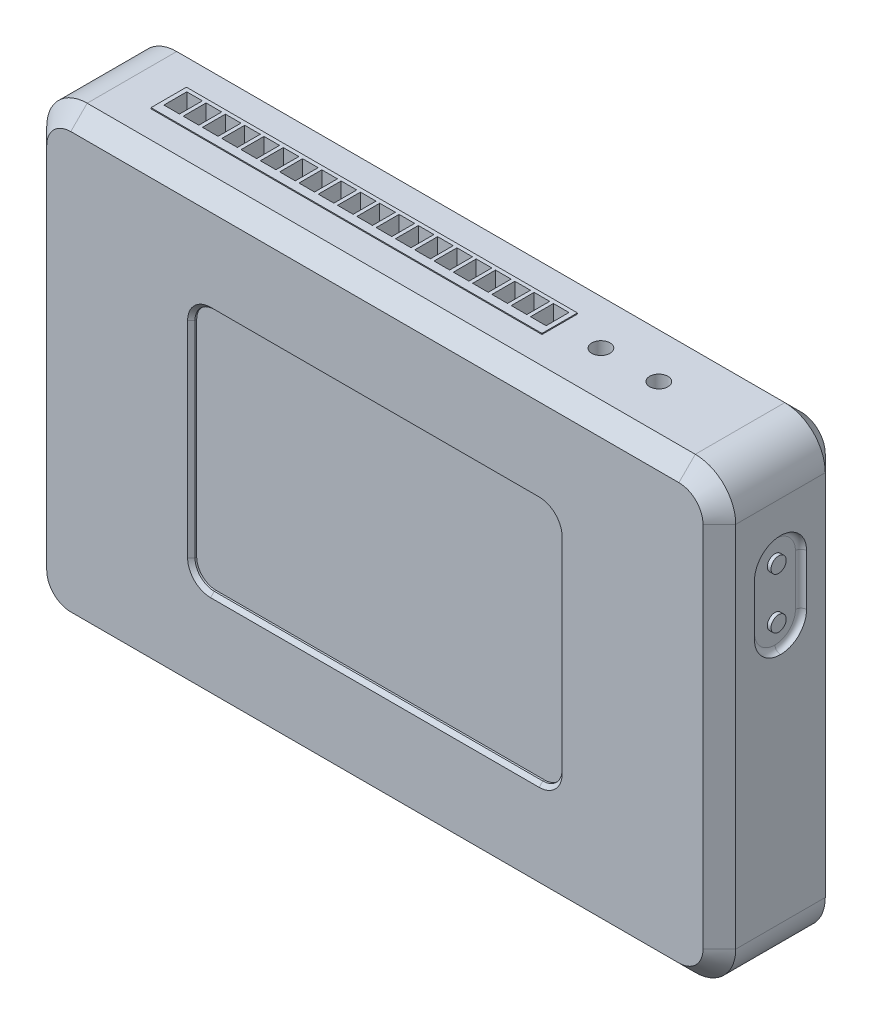
from build123d import *

# Parameters (mm, degrees)
SKETCH1_W           = 136.04687294
SKETCH1_H           = 88.612181424
BOSS_EXTRUDE1_DEPTH = 12.07135
FILLET1_R           = 7.98823523
CHAMFER1_SIZE       = 3.232892188
SKETCH2_W           = 10.287037846
SKETCH2_H           = 20.345437846
CUT_EXTRUDE1_DEPTH  = 1.100644484
FILLET2_R           = 5.143518923
FILLET3_R           = 1.100644484
SKETCH3_R           = 1.5
BOSS_EXTRUDE2_DEPTH = 0.730648272
SKETCH4_R           = 1.7999964
CUT_EXTRUDE2_DEPTH  = 2.54
SKETCH5_W           = 72.4916
SKETCH5_H           = 48.2092
CUT_EXTRUDE3_DEPTH  = 1.0668
FILLET4_R           = 3.81
CHAMFER2_SIZE       = 0.724662508
SKETCH6_W           = 77.2
SKETCH6_H           = 7
BOSS_EXTRUDE3_DEPTH = 0.2
SKETCH7_W           = 3.08
SKETCH7_H           = 4.52
CUT_EXTRUDE4_DEPTH  = 6.95
SKETCH8_W           = 0.8
SKETCH8_H           = 0.8
BOSS_EXTRUDE4_DEPTH = 4.3
SKETCH9_R           = 1.63195
CUT_EXTRUDE5_DEPTH  = 2.54
SKETCH10_W          = 5.67182
SKETCH10_H          = 12.56
SKETCH10_W_2        = 8.4328
SKETCH10_H_2        = 9.3
CUT_EXTRUDE6_DEPTH  = 6.35
CHAMFER3_SIZE       = 2.1866
SKETCH11_W          = 11
SKETCH11_H          = 9
BOSS_EXTRUDE5_DEPTH = 0.508
SKETCH12_R          = 3.2
CUT_EXTRUDE7_DEPTH  = 10
SKETCH13_R          = 1
BOSS_EXTRUDE6_DEPTH = 8
SKETCH14_R          = 1.778
CUT_EXTRUDE8_DEPTH  = 2.75
SKETCH15_W          = 50.8
SKETCH15_H          = 8.8
BOSS_EXTRUDE7_DEPTH = 0.25
CUT_EXTRUDE9_DEPTH  = 6.25
SKETCH17_W          = 0.64
SKETCH17_H          = 0.64
BOSS_EXTRUDE8_DEPTH = 5.5


with BuildPart() as part:
    # Sketch1 → Boss-Extrude1 (new, symmetric)
    with BuildSketch(Plane.XY):
        Rectangle(SKETCH1_W, SKETCH1_H)
    extrude(amount=BOSS_EXTRUDE1_DEPTH, both=True)

    # Fillet1
    fillet1_edges = [part.edges().sort_by_distance(p)[0] for p in [
        (68.02343647, -44.306090712, 0),
        (-68.02343647, -44.306090712, 0),
        (-68.02343647, 44.306090712, 0),
        (68.02343647, 44.306090712, 0),
    ]]
    fillet(fillet1_edges, radius=FILLET1_R)

    # Chamfer1
    chamfer1_edges = [part.edges().sort_by_distance(p)[0] for p in [
        (0, -44.306090712, -12.07135),
        (0, -44.306090712, 12.07135),
        (68.02343647, 0, -12.07135),
        (-68.02343647, 0, -12.07135),
        (0, 44.306090712, -12.07135),
        (65.683736541, -41.966390783, -12.07135),
        (65.683736541, 41.966390783, -12.07135),
        (-65.683736541, 41.966390783, -12.07135),
        (-65.683736541, -41.966390783, -12.07135),
        (-68.02343647, 0, 12.07135),
        (68.02343647, 0, 12.07135),
        (0, 44.306090712, 12.07135),
        (65.683736541, -41.966390783, 12.07135),
        (65.683736541, 41.966390783, 12.07135),
        (-65.683736541, 41.966390783, 12.07135),
        (-65.683736541, -41.966390783, 12.07135),
    ]]
    chamfer(chamfer1_edges, length=CHAMFER1_SIZE)

    # Sketch2 → Cut-Extrude1 (cut)
    with BuildSketch(Plane(origin=(68.02343647, 0, 0), x_dir=(0, 0, -1), z_dir=(1, 0, 0))):
        with Locations((0, 19.801547138)):
            Rectangle(SKETCH2_W, SKETCH2_H)
    extrude(amount=-CUT_EXTRUDE1_DEPTH, mode=Mode.SUBTRACT)

    # Fillet2
    fillet2_edges = [part.edges().sort_by_distance(p)[0] for p in [
        (67.473114228, 9.628828215, -5.143518923),
        (67.473114228, 29.974266061, -5.143518923),
        (67.473114228, 29.974266061, 5.143518923),
        (67.473114228, 9.628828215, 5.143518923),
    ]]
    fillet(fillet2_edges, radius=FILLET2_R - 0.0001)  # a hair under: the kernel refuses the full size

    # Fillet3
    fillet3_edges = [part.edges().sort_by_distance(p)[0] for p in [
        (66.922791986, 28.467793537, 3.637046399),
        (66.922791986, 28.467793537, -3.637046399),
        (66.922791986, 19.801547138, -5.143518923),
        (66.922791986, 11.135300739, -3.637046399),
        (66.922791986, 11.135300739, 3.637046399),
        (66.922791986, 19.801547138, 5.143518923),
    ]]
    fillet(fillet3_edges, radius=FILLET3_R - 0.0001)  # a hair under: the kernel refuses the full size

    # Sketch3 → Boss-Extrude2 (add)
    with BuildSketch(Plane(origin=(66.922791986, 0, 0), x_dir=(0, 0, -1), z_dir=(1, 0, 0))):
        with Locations((0, 24.830747138)):
            Circle(SKETCH3_R)
        with Locations((0, 14.772347138)):
            Circle(SKETCH3_R)
    extrude(amount=BOSS_EXTRUDE2_DEPTH)

    # Sketch4 → Cut-Extrude2 (cut)
    with BuildSketch(Plane(origin=(0, 44.306090712, 0), x_dir=(1, 0, 0), z_dir=(0, 1, 0))):
        with Locations(Location((43.992399188, 0, 0), (0, 0, 270))):
            Circle(SKETCH4_R)
        with Locations(Location((32.562399188, 0, 0), (0, 0, 270))):
            Circle(SKETCH4_R)
    extrude(amount=-CUT_EXTRUDE2_DEPTH, mode=Mode.SUBTRACT)

    # Sketch5 → Cut-Extrude3 (cut)
    with BuildSketch(Plane.XY.offset(12.07135)):
        Rectangle(SKETCH5_W, SKETCH5_H)
    extrude(amount=-CUT_EXTRUDE3_DEPTH, mode=Mode.SUBTRACT)

    # Fillet4
    fillet4_edges = [part.edges().sort_by_distance(p)[0] for p in [
        (-36.2458, -24.1046, 11.53795),
        (-36.2458, 24.1046, 11.53795),
        (36.2458, 24.1046, 11.53795),
        (36.2458, -24.1046, 11.53795),
    ]]
    fillet(fillet4_edges, radius=FILLET4_R)

    # Chamfer2
    chamfer2_edges = [part.edges().sort_by_distance(p)[0] for p in [
        (36.2458, 0, 12.07135),
        (0, -24.1046, 12.07135),
        (0, 24.1046, 12.07135),
        (-36.2458, 0, 12.07135),
        (35.129876836, -22.988676836, 12.07135),
        (35.129876836, 22.988676836, 12.07135),
        (-35.129876836, 22.988676836, 12.07135),
        (-35.129876836, -22.988676836, 12.07135),
    ]]
    chamfer(chamfer2_edges, length=CHAMFER2_SIZE)

    # Sketch6 → Boss-Extrude3 (add)
    with BuildSketch(Plane(origin=(0, 44.306090712, 0), x_dir=(1, 0, 0), z_dir=(0, 1, 0))):
        with Locations((-14.17656353, 0)):
            Rectangle(SKETCH6_W, SKETCH6_H)
    extrude(amount=BOSS_EXTRUDE3_DEPTH)

    # Sketch7 → Cut-Extrude4 (cut)
    with BuildSketch(Plane(origin=(0, 44.506090712, 0), x_dir=(1, 0, 0), z_dir=(0, 1, 0))):
        with Locations((21.98343647, 0.478)):
            Rectangle(SKETCH7_W, SKETCH7_H)
        with Locations((18.17343647, 0.478)):
            Rectangle(SKETCH7_W, SKETCH7_H)
        with Locations((14.36343647, 0.478)):
            Rectangle(SKETCH7_W, SKETCH7_H)
        with Locations((10.55343647, 0.478)):
            Rectangle(SKETCH7_W, SKETCH7_H)
        with Locations((6.74343647, 0.478)):
            Rectangle(SKETCH7_W, SKETCH7_H)
        with Locations((2.93343647, 0.478)):
            Rectangle(SKETCH7_W, SKETCH7_H)
        with Locations((-0.87656353, 0.478)):
            Rectangle(SKETCH7_W, SKETCH7_H)
        with Locations((-4.68656353, 0.478)):
            Rectangle(SKETCH7_W, SKETCH7_H)
        with Locations((-8.49656353, 0.478)):
            Rectangle(SKETCH7_W, SKETCH7_H)
        with Locations((-12.30656353, 0.478)):
            Rectangle(SKETCH7_W, SKETCH7_H)
        with Locations((-16.11656353, 0.478)):
            Rectangle(SKETCH7_W, SKETCH7_H)
        with Locations((-19.92656353, 0.478)):
            Rectangle(SKETCH7_W, SKETCH7_H)
        with Locations((-23.73656353, 0.478)):
            Rectangle(SKETCH7_W, SKETCH7_H)
        with Locations((-27.54656353, 0.478)):
            Rectangle(SKETCH7_W, SKETCH7_H)
        with Locations((-31.35656353, 0.478)):
            Rectangle(SKETCH7_W, SKETCH7_H)
        with Locations((-35.16656353, 0.478)):
            Rectangle(SKETCH7_W, SKETCH7_H)
        with Locations((-38.97656353, 0.478)):
            Rectangle(SKETCH7_W, SKETCH7_H)
        with Locations((-42.78656353, 0.478)):
            Rectangle(SKETCH7_W, SKETCH7_H)
        with Locations((-46.59656353, 0.478)):
            Rectangle(SKETCH7_W, SKETCH7_H)
        with Locations((-50.40656353, 0.478)):
            Rectangle(SKETCH7_W, SKETCH7_H)
    extrude(amount=-CUT_EXTRUDE4_DEPTH, mode=Mode.SUBTRACT)

    # Sketch8 → Boss-Extrude4 (add)
    with BuildSketch(Plane(origin=(0, 37.556090712, 0), x_dir=(1, 0, 0), z_dir=(0, 1, 0))):
        with Locations((18.17343647, 0.478)):
            Rectangle(SKETCH8_W, SKETCH8_H)
        with Locations((21.98343647, 0.478)):
            Rectangle(SKETCH8_W, SKETCH8_H)
        with Locations((14.36343647, 0.478)):
            Rectangle(SKETCH8_W, SKETCH8_H)
        with Locations((10.55343647, 0.478)):
            Rectangle(SKETCH8_W, SKETCH8_H)
        with Locations((6.74343647, 0.478)):
            Rectangle(SKETCH8_W, SKETCH8_H)
        with Locations((2.93343647, 0.478)):
            Rectangle(SKETCH8_W, SKETCH8_H)
        with Locations((-0.87656353, 0.478)):
            Rectangle(SKETCH8_W, SKETCH8_H)
        with Locations((-4.68656353, 0.478)):
            Rectangle(SKETCH8_W, SKETCH8_H)
        with Locations((-8.49656353, 0.478)):
            Rectangle(SKETCH8_W, SKETCH8_H)
        with Locations((-12.30656353, 0.478)):
            Rectangle(SKETCH8_W, SKETCH8_H)
        with Locations((-16.11656353, 0.478)):
            Rectangle(SKETCH8_W, SKETCH8_H)
        with Locations((-19.92656353, 0.478)):
            Rectangle(SKETCH8_W, SKETCH8_H)
        with Locations((-23.73656353, 0.478)):
            Rectangle(SKETCH8_W, SKETCH8_H)
        with Locations((-27.54656353, 0.478)):
            Rectangle(SKETCH8_W, SKETCH8_H)
        with Locations((-31.35656353, 0.478)):
            Rectangle(SKETCH8_W, SKETCH8_H)
        with Locations((-35.16656353, 0.478)):
            Rectangle(SKETCH8_W, SKETCH8_H)
        with Locations((-38.97656353, 0.478)):
            Rectangle(SKETCH8_W, SKETCH8_H)
        with Locations((-42.78656353, 0.478)):
            Rectangle(SKETCH8_W, SKETCH8_H)
        with Locations((-46.59656353, 0.478)):
            Rectangle(SKETCH8_W, SKETCH8_H)
        with Locations((-50.40656353, 0.478)):
            Rectangle(SKETCH8_W, SKETCH8_H)
    extrude(amount=BOSS_EXTRUDE4_DEPTH)

    # Sketch9 → Cut-Extrude5 (cut)
    with BuildSketch(Plane(origin=(0, 0, -12.07135), x_dir=(-1, 0, 0), z_dir=(0, 0, -1))):
        with Locations((44.77656353, 22.1)):
            Circle(SKETCH9_R)
        with Locations((44.77656353, -22.1)):
            Circle(SKETCH9_R)
        with Locations((-35.22343647, 0)):
            Circle(SKETCH9_R)
    extrude(amount=-CUT_EXTRUDE5_DEPTH, mode=Mode.SUBTRACT)

    # Sketch10 → Cut-Extrude6 (cut)
    with BuildSketch(Plane.ZY.offset(68.02343647)):
        with Locations((0, 19.690090712)):
            Rectangle(SKETCH10_W, SKETCH10_H)
        with Locations((1.38049, 2.616090712)):
            Rectangle(SKETCH10_W_2, SKETCH10_H_2)
    extrude(amount=-CUT_EXTRUDE6_DEPTH, mode=Mode.SUBTRACT)

    # Chamfer3
    chamfer3_edges = [part.edges().sort_by_distance(p)[0] for p in [
        (-64.84843647, 7.266090712, 5.59689),
        (-64.84843647, -2.033909288, 5.59689),
    ]]
    chamfer(chamfer3_edges, length=CHAMFER3_SIZE)

    # Sketch11 → Boss-Extrude5 (add)
    with BuildSketch(Plane.ZY.offset(68.02343647)):
        with Locations((1.500008, -12.326090712)):
            Rectangle(SKETCH11_W, SKETCH11_H)
    extrude(amount=BOSS_EXTRUDE5_DEPTH)

    # Sketch12 → Cut-Extrude7 (cut)
    with BuildSketch(Plane.ZY.offset(68.53143647)):
        with Locations((2.500008, -12.326090712)):
            Circle(SKETCH12_R)
    extrude(amount=-CUT_EXTRUDE7_DEPTH, mode=Mode.SUBTRACT)

    # Sketch13 → Boss-Extrude6 (add)
    with BuildSketch(Plane.ZY.offset(58.53143647)):
        with Locations((2.500008, -12.326090712)):
            Circle(SKETCH13_R)
    extrude(amount=BOSS_EXTRUDE6_DEPTH)

    # Sketch14 → Cut-Extrude8 (cut)
    with BuildSketch(Plane.ZY.offset(68.02343647)):
        with Locations((0, -23.606090712)):
            Circle(SKETCH14_R)
    extrude(amount=-CUT_EXTRUDE8_DEPTH, mode=Mode.SUBTRACT)

    # Sketch15 → Boss-Extrude7 (add)
    with BuildSketch(Plane.XZ.offset(44.306090712)):
        with Locations((28.86456353, 1.9)):
            Rectangle(SKETCH15_W, SKETCH15_H)
        with Locations((-28.28543647, 1.9)):
            Rectangle(SKETCH15_W, SKETCH15_H)
    extrude(amount=BOSS_EXTRUDE7_DEPTH)

    # Sketch16 → Cut-Extrude9 (cut)
    with BuildSketch(Plane.XZ.offset(44.556090712)):
        Polygon((4.519828848, 5.1), (26.61456353, 5.1), (26.61456353, 6.3), (31.11456353, 6.3), (31.11456353, 5.1), (53.019828848, 5.1), (53.019828848, -1.3), (4.519828848, -1.3), align=None)
        Polygon((-52.53543647, -1.3), (-4.03543647, -1.3), (-4.03543647, 5.1), (-26.03543647, 5.1), (-26.03543647, 6.3), (-30.53543647, 6.3), (-30.53543647, 5.1), (-52.53543647, 5.1), align=None)
    extrude(amount=-CUT_EXTRUDE9_DEPTH, mode=Mode.SUBTRACT)

    # Sketch17 → Boss-Extrude8 (add)
    with BuildSketch(Plane.XZ.offset(38.306090712)):
        with Locations((-25.74543647, 3.17)):
            Rectangle(SKETCH17_W, SKETCH17_H)
        with Locations((-28.28543647, 3.17)):
            Rectangle(SKETCH17_W, SKETCH17_H)
        with Locations((-28.28543647, 0.63)):
            Rectangle(SKETCH17_W, SKETCH17_H)
        with Locations((-25.74543647, 0.63)):
            Rectangle(SKETCH17_W, SKETCH17_H)
        with Locations((-23.20543647, 3.17)):
            Rectangle(SKETCH17_W, SKETCH17_H)
        with Locations((-23.20543647, 0.63)):
            Rectangle(SKETCH17_W, SKETCH17_H)
        with Locations((-20.66543647, 3.17)):
            Rectangle(SKETCH17_W, SKETCH17_H)
        with Locations((-20.66543647, 0.63)):
            Rectangle(SKETCH17_W, SKETCH17_H)
        with Locations((-18.12543647, 3.17)):
            Rectangle(SKETCH17_W, SKETCH17_H)
        with Locations((-18.12543647, 0.63)):
            Rectangle(SKETCH17_W, SKETCH17_H)
        with Locations((-15.58543647, 3.17)):
            Rectangle(SKETCH17_W, SKETCH17_H)
        with Locations((-15.58543647, 0.63)):
            Rectangle(SKETCH17_W, SKETCH17_H)
        with Locations((-13.04543647, 3.17)):
            Rectangle(SKETCH17_W, SKETCH17_H)
        with Locations((-13.04543647, 0.63)):
            Rectangle(SKETCH17_W, SKETCH17_H)
        with Locations((-10.50543647, 3.17)):
            Rectangle(SKETCH17_W, SKETCH17_H)
        with Locations((-10.50543647, 0.63)):
            Rectangle(SKETCH17_W, SKETCH17_H)
        with Locations((-7.96543647, 3.17)):
            Rectangle(SKETCH17_W, SKETCH17_H)
        with Locations((-7.96543647, 0.63)):
            Rectangle(SKETCH17_W, SKETCH17_H)
        with Locations((-30.82543647, 3.17)):
            Rectangle(SKETCH17_W, SKETCH17_H)
        with Locations((-30.82543647, 0.63)):
            Rectangle(SKETCH17_W, SKETCH17_H)
        with Locations((-33.36543647, 3.17)):
            Rectangle(SKETCH17_W, SKETCH17_H)
        with Locations((-33.36543647, 0.63)):
            Rectangle(SKETCH17_W, SKETCH17_H)
        with Locations((-35.90543647, 3.17)):
            Rectangle(SKETCH17_W, SKETCH17_H)
        with Locations((-35.90543647, 0.63)):
            Rectangle(SKETCH17_W, SKETCH17_H)
        with Locations((-38.44543647, 3.17)):
            Rectangle(SKETCH17_W, SKETCH17_H)
        with Locations((-38.44543647, 0.63)):
            Rectangle(SKETCH17_W, SKETCH17_H)
        with Locations((-40.98543647, 3.17)):
            Rectangle(SKETCH17_W, SKETCH17_H)
        with Locations((-40.98543647, 0.63)):
            Rectangle(SKETCH17_W, SKETCH17_H)
        with Locations((-43.52543647, 3.17)):
            Rectangle(SKETCH17_W, SKETCH17_H)
        with Locations((-43.52543647, 0.63)):
            Rectangle(SKETCH17_W, SKETCH17_H)
        with Locations((-46.06543647, 3.17)):
            Rectangle(SKETCH17_W, SKETCH17_H)
        with Locations((-46.06543647, 0.63)):
            Rectangle(SKETCH17_W, SKETCH17_H)
        with Locations((-48.60543647, 3.17)):
            Rectangle(SKETCH17_W, SKETCH17_H)
        with Locations((-48.60543647, 0.63)):
            Rectangle(SKETCH17_W, SKETCH17_H)
    boss_extrude8 = extrude(amount=BOSS_EXTRUDE8_DEPTH)

    # Mirror1: Boss-Extrude8 across plane
    add(boss_extrude8.mirror(Plane.ZY.offset(-0.242196189)))


solid = part.part
